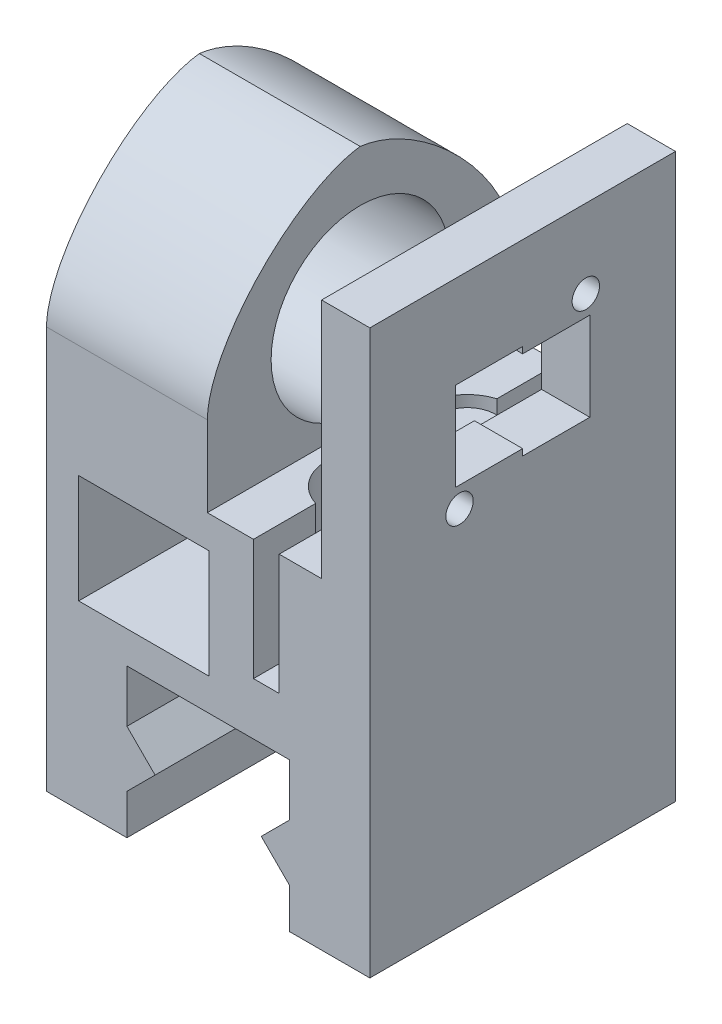
from build123d import *

# Parameters (mm, degrees)
SKETCH1_W                = 16.2
SKETCH1_H                = 13.5
BOSS_EXTRUDE1_DEPTH      = 19
SKETCH2_W                = 20
SKETCH2_H                = 38
BOSS_EXTRUDE2_DEPTH      = 30
FILLET2_SIZE             = 20
SKETCH7_W                = 6
SKETCH7_H                = 38
BOSS_EXTRUDE6_DEPTH      = 30
CUT_EXTRUDE1_DEPTH       = 69.038885968
CUT_EXTRUDE1_DEPTH_BACK  = 31
SKETCH3_R                = 11.075
SKETCH5_W                = 2.5
SKETCH5_H                = 38
BOSS_EXTRUDE3_DEPTH      = 30
SKETCH11_R               = 3.5
CUT_EXTRUDE5_DEPTH       = 15
SKETCH9_R                = 2.2
BOSS_EXTRUDE7_DEPTH      = 8
M3_CLEARANCE_HOLE3_D     = 3.4
M3_CLEARANCE_HOLE3_DEPTH = 8
CUT_EXTRUDE6_DEPTH       = 10


with BuildPart() as part:
    # Sketch1 → Boss-Extrude1 (new, symmetric)
    with BuildSketch(Plane.XY):
        Polygon((-10.1, 0), (10.1, 0), (10.1, -6.5), (6.6, -10), (10.1, -13.5), (10.1, -18.5), (20.1, -18.5), (20.1, 21.5), (-20.1, 21.5), (-20.1, -18.5), (-10.1, -18.5), (-10.1, -13.5), (-6.6, -10), (-10.1, -6.5), align=None)
        with Locations((-8, 10.75)):
            Rectangle(SKETCH1_W, SKETCH1_H, mode=Mode.SUBTRACT)
    extrude(amount=BOSS_EXTRUDE1_DEPTH, both=True)

    # Sketch2 → Boss-Extrude2 (add)
    with BuildSketch(Plane(origin=(0, 21.5, 0), x_dir=(1, 0, 0), z_dir=(0, 1, 0))):
        with Locations((-10.1, 0)):
            Rectangle(SKETCH2_W, SKETCH2_H)
    extrude(amount=BOSS_EXTRUDE2_DEPTH)

    # Fillet2
    # a fillet whose section is not a circle: 20 mm, written as the material it takes off along each edge
    with BuildSketch(Plane(origin=(-70.1, 51.5, -19), x_dir=(0, 0, 1), z_dir=(1, 0, 0)), Plane(origin=(49.9, 51.5, 19), x_dir=(0, 0, -1), z_dir=(-1, 0, 0))) as fillet2_piece_1:
        with BuildLine():
            Bezier((FILLET2_SIZE, 0), (0, 0), (0, FILLET2_SIZE), weights=[1, 0.428571429, 1])
            Line((0, FILLET2_SIZE), (0, 0))
            Line((0, 0), (FILLET2_SIZE, 0))
        make_face()
    extrude(amount=120, mode=Mode.SUBTRACT)

    # Sketch7 → Boss-Extrude6 (add)
    with BuildSketch(Plane(origin=(0, 21.5, 0), x_dir=(1, 0, 0), z_dir=(0, 1, 0))):
        with Locations((17.1, 0)):
            Rectangle(SKETCH7_W, SKETCH7_H)
    extrude(amount=BOSS_EXTRUDE6_DEPTH)

    # Sketch3 → Cut-Extrude1 (cut, two sides: drawn at the far end of the back side and taken through both)
    with BuildSketch(Plane.ZY.offset(20.1).offset(-CUT_EXTRUDE1_DEPTH_BACK)):
        with Locations(Location((0, 34, 0), (0, 0, 90))):
            Circle(SKETCH3_R)
    extrude(amount=CUT_EXTRUDE1_DEPTH + CUT_EXTRUDE1_DEPTH_BACK, mode=Mode.SUBTRACT)

    # Sketch5 → Boss-Extrude3 (add)
    with BuildSketch(Plane(origin=(0, 21.5, 0), x_dir=(1, 0, 0), z_dir=(0, 1, 0))):
        with Locations((18.85, 0)):
            Rectangle(SKETCH5_W, SKETCH5_H)
    extrude(amount=BOSS_EXTRUDE3_DEPTH)

    # Sketch11 → Cut-Extrude5 (cut)
    with BuildSketch(Plane(origin=(0, 21.5, 0), x_dir=(1, 0, 0), z_dir=(0, 1, 0))):
        with BuildLine():
            Line((5.63, -11.262128847), (5.63, -19))
            Line((5.63, -19), (8.83, -19))
            Line((8.83, -19), (8.83, -11.262128847))
            ThreePointArc((8.83, -11.262128847), (11.648710219, -9.274904579), (12.73, -6))
            Line((12.73, -6), (12.73, 6))
            ThreePointArc((12.73, 6), (11.648710219, 9.274904579), (8.83, 11.262128847))
            Line((8.83, 11.262128847), (8.83, 19))
            Line((8.83, 19), (5.63, 19))
            Line((5.63, 19), (5.63, 11.262128847))
            ThreePointArc((5.63, 11.262128847), (2.811289781, 9.274904579), (1.73, 6))
            Line((1.73, 6), (1.73, -6))
            ThreePointArc((1.73, -6), (2.811289781, -9.274904579), (5.63, -11.262128847))
        make_face()
        with Locations(Location((7.23, 6, 0), (0, 0, 180))):
            Circle(SKETCH11_R, mode=Mode.SUBTRACT)
        with Locations(Location((7.23, -6, 0), (0, 0, 180))):
            Circle(SKETCH11_R, mode=Mode.SUBTRACT)
    extrude(amount=-CUT_EXTRUDE5_DEPTH, mode=Mode.SUBTRACT)

    # Sketch9 → Boss-Extrude7 (add)
    with BuildSketch(Plane(origin=(20.1, 0, 0), x_dir=(0, 0, -1), z_dir=(1, 0, 0))):
        with Locations(Location((7.85, 41.75, 0), (0, 0, 90))):
            Circle(SKETCH9_R)
        with Locations(Location((-7.85, 26.45, 0), (0, 0, 90))):
            Circle(SKETCH9_R)
    extrude(amount=-BOSS_EXTRUDE7_DEPTH)

    # M3 Clearance Hole3
    with Locations(Plane(origin=(12.1, 41.75, -7.85), x_dir=(0, -1, 0), z_dir=(-1, 0, 0))):
        with Locations((0, 0), (15.3, 15.7)):
            Hole(M3_CLEARANCE_HOLE3_D / 2, depth=M3_CLEARANCE_HOLE3_DEPTH)

    # Sketch19 → Cut-Extrude6 (cut)
    with BuildSketch(Plane(origin=(20.1, 0, 0), x_dir=(0, 0, -1), z_dir=(1, 0, 0))):
        Polygon((0, 39.2), (8.35, 39.2), (8.35, 28.2), (0, 28.2), (0, 29), (-8.35, 29), (-8.35, 40), (0, 40), align=None)
    extrude(amount=-CUT_EXTRUDE6_DEPTH, mode=Mode.SUBTRACT)


solid = part.part
